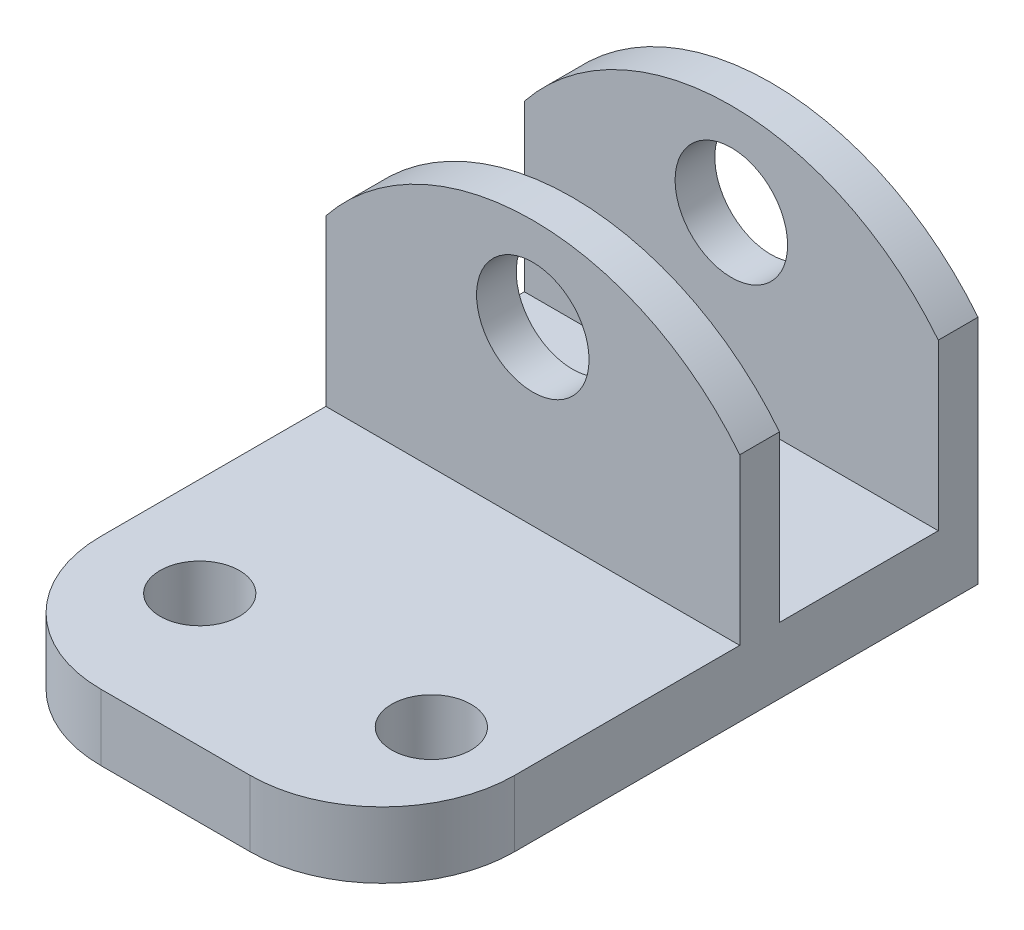
from build123d import *

# Parameters (mm, degrees)
BOSS_EXTRUDE1_OUTLINE_R     = 3.500000003
BOSS_EXTRUDE1_OUTLINE_R_2   = 3.500000005
BOSS_EXTRUDE1_DEPTH         = 8
BOSS_EXTRUDE1_START         = 8
BOSS_EXTRUDE1_2_DEPTH       = 13
BOSS_EXTRUDE1_START_2       = 20.176470589
BOSS_EXTRUDE1_3_OUTLINE_W   = 15
BOSS_EXTRUDE1_3_OUTLINE_H   = 8
BOSS_EXTRUDE1_3_DEPTH       = 29.823529411
BOSS_EXTRUDE1_4_DEPTH       = 14.823529411
BOSS_EXTRUDE1_5_OUTLINE_R   = 1.75
BOSS_EXTRUDE1_5_OUTLINE_R_2 = 3.500000003
BOSS_EXTRUDE1_5_OUTLINE_R_3 = 1.749999996
BOSS_EXTRUDE1_5_OUTLINE_R_4 = 3.500000005
BOSS_EXTRUDE1_5_OUTLINE_R_5 = 1.749999999
BOSS_EXTRUDE1_5_DEPTH       = 4
BOSS_EXTRUDE1_START_3       = -34
BOSS_EXTRUDE1_6_OUTLINE_R   = 1.749999996
BOSS_EXTRUDE1_6_DEPTH       = 9
BOSS_EXTRUDE1_START_4       = 2.590816236
BOSS_EXTRUDE1_7_DEPTH       = 13.213162803
SKETCH2_W                   = 49.146856184
SKETCH2_H                   = 24.85114674
CUT_EXTRUDE1_DEPTH          = 20
SKETCH4_R                   = 5.607924621
SKETCH4_R_2                 = 5.608756875
BOSS_EXTRUDE2_DEPTH         = 8
SKETCH5_W                   = 3
SKETCH5_H                   = 8
BOSS_EXTRUDE3_DEPTH         = 17
SKETCH6_R                   = 3.5
CUT_EXTRUDE2_DEPTH          = 25
CUT_EXTRUDE3_DEPTH          = 59.429444632
CUT_EXTRUDE3_DEPTH_BACK     = 59.429444632
SKETCH7_W                   = 9.630467125
SKETCH7_H                   = 58.787662196
SKETCH8_W                   = 43
SKETCH8_H                   = 25
BOSS_EXTRUDE4_DEPTH         = 8
SKETCH9_W                   = 43
SKETCH9_H                   = 25
CUT_EXTRUDE6_DEPTH          = 11
SKETCH10_R                  = 3
CUT_EXTRUDE7_DEPTH          = 10
SKETCH11_W                  = 44.092215153
SKETCH11_H                  = 53.727113244
CUT_EXTRUDE8_DEPTH          = 10
SKETCH13_W                  = 11.72841244
SKETCH13_H                  = 25
CUT_EXTRUDE9_DEPTH          = 10
SKETCH14_W                  = 31.27158756
SKETCH14_H                  = 8
BOSS_EXTRUDE5_DEPTH         = 20
SKETCH15_W                  = 31.27158756
SKETCH15_H                  = 3
BOSS_EXTRUDE6_DEPTH         = 20
SKETCH16_R                  = 4.25
CUT_EXTRUDE12_DEPTH         = 20
SKETCH17_W                  = 31.27158756
SKETCH17_H                  = 45
CUT_EXTRUDE13_DEPTH         = 3
FILLET1_R                   = 10


with BuildPart() as part:
    # Boss-Extrude1: read off the stored shape, not the designer's step
    # Boss-Extrude1 outline → Boss-Extrude1 (new body)
    with BuildSketch(Plane(origin=(0, 0, 0), x_dir=(1, 0, 0), z_dir=(0, 1, 0))):
        with BuildLine():
            ThreePointArc((-3.5, -5), (0, -1.5), (3.5, -5))
            Line((3.5, -5), (3.5, -8))
            Line((3.5, -8), (4, -8))
            Line((4, -8), (25, 13.000000001))
            Line((25, 13.000000001), (25, 33))
            Line((25, 33), (-23, 33))
            Line((-23, 33), (-23, 25))
            Line((-23, 25), (-20, 25))
            Line((-20, 25), (-20, 8))
            Line((-20, 8), (-4, -8))
            Line((-4, -8), (-3.5, -8))
            Line((-3.5, -8), (-3.5, -5))
        make_face()
        with Locations((-10, 15)):
            Circle(BOSS_EXTRUDE1_OUTLINE_R, mode=Mode.SUBTRACT)
        with Locations((10, 15)):
            Circle(BOSS_EXTRUDE1_OUTLINE_R_2, mode=Mode.SUBTRACT)
    extrude(amount=BOSS_EXTRUDE1_DEPTH)

    # Boss-Extrude1 2 outline → Boss-Extrude1 2 (add)
    with BuildSketch(Plane(origin=(0, 0, 0), x_dir=(1, 0, 0), z_dir=(0, 1, 0)).offset(BOSS_EXTRUDE1_START)):
        Polygon((20, 25), (20, 8), (25, 13.000000001), (25, 33), (-23, 33), (-23, 25), align=None)
    extrude(amount=BOSS_EXTRUDE1_2_DEPTH)

    # Boss-Extrude1 3 outline → Boss-Extrude1 3 (add)
    with BuildSketch(Plane(origin=(0, 0, 0), x_dir=(1, 0, 0), z_dir=(0, 1, 0)).offset(BOSS_EXTRUDE1_START_2)):
        with Locations((17.5, 29)):
            Rectangle(BOSS_EXTRUDE1_3_OUTLINE_W, BOSS_EXTRUDE1_3_OUTLINE_H)
    extrude(amount=BOSS_EXTRUDE1_3_DEPTH)

    # Boss-Extrude1 4 outline → Boss-Extrude1 4 (add)
    with BuildSketch(Plane(origin=(0, 0, 0), x_dir=(1, 0, 0), z_dir=(0, 1, 0)).offset(BOSS_EXTRUDE1_START_2)):
        Polygon((20, 25), (20, 8), (25, 13.000000001), (25, 25), align=None)
    extrude(amount=BOSS_EXTRUDE1_4_DEPTH)

    # Boss-Extrude1 5 outline → Boss-Extrude1 5 (add)
    # profile 1 of 3: a face of its own
    with BuildSketch(Plane(origin=(0, 0, 0), x_dir=(1, 0, 0), z_dir=(0, 1, 0))):
        with BuildLine():
            Line((3.5, -8), (3.5, -5))
            ThreePointArc((3.5, -5), (0, -1.5), (-3.5, -5))
            Line((-3.5, -5), (-3.5, -8))
            Line((-3.5, -8), (3.5, -8))
        make_face()
        with Locations((0, -5)):
            Circle(BOSS_EXTRUDE1_5_OUTLINE_R, mode=Mode.SUBTRACT)
    # profile 2 of 3: a face of its own
    with BuildSketch(Plane(origin=(0, 0, 0), x_dir=(1, 0, 0), z_dir=(0, 1, 0))):
        with Locations((-10, 15)):
            Circle(BOSS_EXTRUDE1_5_OUTLINE_R_2)
        with Locations((-10, 15)):
            Circle(BOSS_EXTRUDE1_5_OUTLINE_R_3, mode=Mode.SUBTRACT)
    # profile 3 of 3: a face of its own
    with BuildSketch(Plane(origin=(0, 0, 0), x_dir=(1, 0, 0), z_dir=(0, 1, 0))):
        with Locations((10, 15)):
            Circle(BOSS_EXTRUDE1_5_OUTLINE_R_4)
        with Locations((10, 15)):
            Circle(BOSS_EXTRUDE1_5_OUTLINE_R_5, mode=Mode.SUBTRACT)
    extrude(amount=BOSS_EXTRUDE1_5_DEPTH)

    # Boss-Extrude1 6 outline → Boss-Extrude1 6 (cut)
    with BuildSketch(Plane.XY.offset(BOSS_EXTRUDE1_START_3)):
        with BuildLine():
            Line((-20.000000002, 18), (7, 18))
            ThreePointArc((7, 18), (9.121320344, 18.878679656), (10, 21))
            Line((10, 21), (-23, 21))
            Line((-23, 21), (-23, 15.000000003))
            Line((-23, 15.000000003), (-20.000000002, 18))
        make_face()
        Polygon((25, 50), (20, 50), (25, 42), align=None)
        Polygon((10, 50), (10, 46.999999997), (13.000000003, 49.999999997), align=None)
        with Locations((14.5, 13.5)):
            Circle(BOSS_EXTRUDE1_6_OUTLINE_R)
        with Locations((-16.5, 13.5)):
            Circle(BOSS_EXTRUDE1_6_OUTLINE_R)
        with Locations((14.5, 44.5)):
            Circle(BOSS_EXTRUDE1_6_OUTLINE_R)
    extrude(amount=BOSS_EXTRUDE1_6_DEPTH, mode=Mode.SUBTRACT)

    # Boss-Extrude1 7 outline → Boss-Extrude1 7 (cut)
    with BuildSketch(Plane(origin=(0, 0, 0), x_dir=(1, 0, 0), z_dir=(0, 0.6291982286909779, 0.7772448706888557)).offset(BOSS_EXTRUDE1_START_4)):
        Polygon((20, 15.915014019), (25, 23.861635248), (25, 42.933526191), (20, 42.933526191), align=None)
    extrude(amount=BOSS_EXTRUDE1_7_DEPTH, mode=Mode.SUBTRACT)

    # Sketch2 → Cut-Extrude1 (cut)
    with BuildSketch(Plane(origin=(0, 0, 0), x_dir=(-1, 0, 0), z_dir=(0, -1, 0))):
        with Locations((-4.573428092, -4.42557337)):
            Rectangle(SKETCH2_W, SKETCH2_H)
    extrude(amount=-CUT_EXTRUDE1_DEPTH, mode=Mode.SUBTRACT)

    # Sketch4 → Boss-Extrude2 (add, through all)
    with BuildSketch(Plane(origin=(0, 8, 0), x_dir=(1, 0, 0), z_dir=(0, 1, 0))):
        with Locations(Location((-10, 15, 0), (0, 0, 270))):
            Circle(SKETCH4_R)
        with Locations(Location((10, 15, 0), (0, 0, 270))):
            Circle(SKETCH4_R_2)
    extrude(amount=-BOSS_EXTRUDE2_DEPTH)

    # Sketch5 → Boss-Extrude3 (add)
    with BuildSketch(Plane.XY.offset(-25)):
        with Locations((-21.5, 4)):
            Rectangle(SKETCH5_W, SKETCH5_H)
    extrude(amount=BOSS_EXTRUDE3_DEPTH)

    # Sketch6 → Cut-Extrude2 (cut)
    with BuildSketch(Plane(origin=(0, 8, 0), x_dir=(1, 0, 0), z_dir=(0, 1, 0))):
        with Locations(Location((-14.7, 16.3, 0), (0, 0, 270))):
            Circle(SKETCH6_R)
        with Locations(Location((2.8, 16.3, 0), (0, 0, 270))):
            Circle(SKETCH6_R)
    extrude(amount=-CUT_EXTRUDE2_DEPTH, mode=Mode.SUBTRACT)

    # Sketch7 → Cut-Extrude3 (cut, two sides: drawn at the far end of the back side and taken through both)
    with BuildSketch(Plane.XY.offset(-25).offset(-CUT_EXTRUDE3_DEPTH_BACK)):
        with Locations((24.815233563, 20.606168902)):
            Rectangle(SKETCH7_W, SKETCH7_H)
    extrude(amount=CUT_EXTRUDE3_DEPTH + CUT_EXTRUDE3_DEPTH_BACK, mode=Mode.SUBTRACT)

    # Sketch8 → Boss-Extrude4 (add)
    with BuildSketch(Plane(origin=(0, 0, 0), x_dir=(-1, 0, 0), z_dir=(0, -1, 0))):
        with Locations((1.5, 20.5)):
            Rectangle(SKETCH8_W, SKETCH8_H)
    extrude(amount=-BOSS_EXTRUDE4_DEPTH)

    # Sketch9 → Cut-Extrude6 (cut)
    with BuildSketch(Plane(origin=(0, 0, 0), x_dir=(-1, 0, 0), z_dir=(0, -1, 0))):
        with Locations((1.5, 20.5)):
            Rectangle(SKETCH9_W, SKETCH9_H)
    extrude(amount=CUT_EXTRUDE6_DEPTH, mode=Mode.SUBTRACT)

    # Sketch10 → Cut-Extrude7 (cut)
    with BuildSketch(Plane(origin=(0, 0, 0), x_dir=(-1, 0, 0), z_dir=(0, -1, 0))):
        with Locations(Location((-13.7, 18, 0), (0, 0, 90))):
            Circle(SKETCH10_R)
        with Locations(Location((3.8, 18, 0), (0, 0, 90))):
            Circle(SKETCH10_R)
    extrude(amount=-CUT_EXTRUDE7_DEPTH, mode=Mode.SUBTRACT)

    # Sketch11 → Cut-Extrude8 (cut)
    with BuildSketch(Plane.XY.offset(-25)):
        with Locations((-2.046107577, 34.863556622)):
            Rectangle(SKETCH11_W, SKETCH11_H)
    extrude(amount=-CUT_EXTRUDE8_DEPTH, mode=Mode.SUBTRACT)

    # Sketch13 → Cut-Extrude9 (cut)
    with BuildSketch(Plane(origin=(0, 8, 0), x_dir=(1, 0, 0), z_dir=(0, 1, 0))):
        with Locations((-17.13579378, 20.5)):
            Rectangle(SKETCH13_W, SKETCH13_H)
    extrude(amount=-CUT_EXTRUDE9_DEPTH, mode=Mode.SUBTRACT)

    # Sketch14 → Boss-Extrude5 (add)
    with BuildSketch(Plane(origin=(0, 0, -33), x_dir=(-1, 0, 0), z_dir=(0, 0, -1))):
        with Locations((-4.36420622, 4)):
            Rectangle(SKETCH14_W, SKETCH14_H)
    extrude(amount=BOSS_EXTRUDE5_DEPTH)

    # Sketch15 → Boss-Extrude6 (add)
    with BuildSketch(Plane(origin=(0, 8, 0), x_dir=(1, 0, 0), z_dir=(0, 1, 0))):
        with Locations((4.36420622, 51.5)):
            Rectangle(SKETCH15_W, SKETCH15_H)
        with Locations((4.36420622, 36.5)):
            Rectangle(SKETCH15_W, SKETCH15_H)
    extrude(amount=BOSS_EXTRUDE6_DEPTH)

    # Sketch16 → Cut-Extrude12 (cut)
    with BuildSketch(Plane.XY.offset(-35)):
        with Locations((4.36420622, 21)):
            Circle(SKETCH16_R)
        with BuildLine():
            Line((20, 20.470844112), (31.027362531, 31.498206643))
            Line((31.027362531, 31.498206643), (10.435744992, 49.378328991))
            Line((10.435744992, 49.378328991), (-8.588152436, 51.031027656))
            Line((-8.588152436, 51.031027656), (-22.41621992, 31.498206643))
            Line((-22.41621992, 31.498206643), (-11.27158756, 20.470844112))
            ThreePointArc((-11.27158756, 20.470844112), (-4.31286465, 26.019668175), (4.36420622, 28))
            ThreePointArc((4.36420622, 28), (13.04127709, 26.019668175), (20, 20.470844112))
        make_face()
    extrude(amount=-CUT_EXTRUDE12_DEPTH, mode=Mode.SUBTRACT)

    # Sketch17 → Cut-Extrude13 (cut)
    with BuildSketch(Plane(origin=(0, 0, 0), x_dir=(-1, 0, 0), z_dir=(0, -1, 0))):
        with Locations((-4.36420622, 30.5)):
            Rectangle(SKETCH17_W, SKETCH17_H)
    extrude(amount=-CUT_EXTRUDE13_DEPTH, mode=Mode.SUBTRACT)

    # Fillet1
    fillet1_edges = [part.edges().sort_by_distance(p)[0] for p in [
        (-11.27158756, 5.5, -8),
        (19.999999999, 5.5, -8),
    ]]
    fillet(fillet1_edges, radius=FILLET1_R)


solid = part.part
